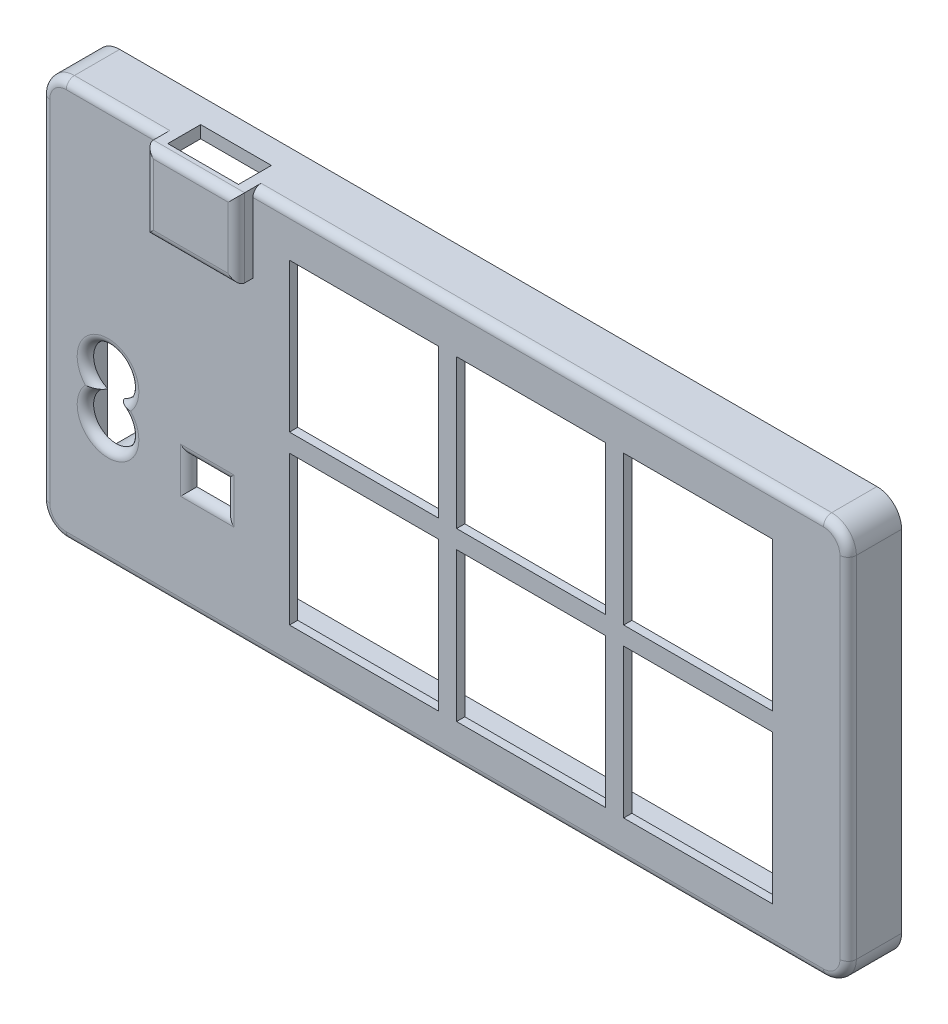
from build123d import *

# Parameters (mm, degrees)
SKETCH3_W                 = 98.075
SKETCH3_H                 = 48.545
SKETCH3_W_2               = 95.075
SKETCH3_H_2               = 45.545
WALL_DEPTH                = 6.5
SKETCH4_W                 = 98.075
SKETCH4_H                 = 48.545
TOPFACE_DEPTH             = 1
SKETCH7_R                 = 3
STANDOFFS_DEPTH           = 5.5
M2X0_4_TAPPED_HOLE1_D     = 1.6
M2X0_4_TAPPED_HOLE1_DEPTH = 4
M2X0_4_TAPPED_HOLE1_TIP   = 0.480688495
SKETCH5_W                 = 18.1
SKETCH5_H                 = 18.1
SKETCH5_W_2               = 4.5
SKETCH5_H_2               = 3.5
KEYCUT_DEPTH              = 210.455337542
SKETCH9_W                 = 11.1
SKETCH9_H                 = 9.5
USBEXTRUDE_DEPTH          = 2
SKETCH12_W                = 8.6
SKETCH12_H                = 4
USBCUT_DEPTH              = 8
FILLETSIDE_R              = 3
FILLETSIDEINNER_R         = 1.5
FILLETTOP_R               = 1
FILLETTOPINNER_R          = 1


with BuildPart() as part:
    # Sketch3 → Wall (new body)
    with BuildSketch(Plane.XY.offset(1.5)):
        with Locations((111.4425, -110.1725)):
            Rectangle(SKETCH3_W, SKETCH3_H)
        with Locations((111.4425, -110.1725)):
            Rectangle(SKETCH3_W_2, SKETCH3_H_2, mode=Mode.SUBTRACT)
    extrude(amount=WALL_DEPTH)

    # Sketch4 → TopFace (add)
    with BuildSketch(Plane.XY.offset(8)):
        with Locations((111.4425, -110.1725)):
            Rectangle(SKETCH4_W, SKETCH4_H)
    extrude(amount=-TOPFACE_DEPTH)

    # Sketch7 → Standoffs (add)
    with BuildSketch(Plane(origin=(0, 0, 7), x_dir=(-1, 0, 0), z_dir=(0, 0, -1))):
        with Locations(Location((-153.035, -93.345, 0), (0, 0, 180))):
            Circle(SKETCH7_R)
        with Locations(Location((-69.85, -93.98, 0), (0, 0, 180))):
            Circle(SKETCH7_R)
        with Locations(Location((-69.85, -127, 0), (0, 0, 180))):
            Circle(SKETCH7_R)
        with Locations(Location((-153.035, -127, 0), (0, 0, 180))):
            Circle(SKETCH7_R)
    extrude(amount=STANDOFFS_DEPTH)

    # M2x0.4 Tapped Hole1
    with Locations(Plane(origin=(0, 0, 1.5), x_dir=(-1, 0, 0), z_dir=(0, 0, -1))):
        with Locations((-153.035, -93.345), (-69.85, -93.98), (-153.035, -127), (-69.85, -127)):
            Hole(M2X0_4_TAPPED_HOLE1_D / 2, depth=M2X0_4_TAPPED_HOLE1_DEPTH)
            with Locations((0, 0, -(M2X0_4_TAPPED_HOLE1_DEPTH + M2X0_4_TAPPED_HOLE1_TIP / 2))):  # 118° drill point
                Cone(0, M2X0_4_TAPPED_HOLE1_D / 2, M2X0_4_TAPPED_HOLE1_TIP, mode=Mode.SUBTRACT)

    # Sketch5 → KeyCut (cut, through all)
    with BuildSketch(Plane.XY.offset(8)):
        with Locations((142.24, -120.65)):
            Rectangle(SKETCH5_W, SKETCH5_H)
        with Locations((121.92, -120.65)):
            Rectangle(SKETCH5_W, SKETCH5_H)
        with Locations((101.6, -120.65)):
            Rectangle(SKETCH5_W, SKETCH5_H)
        with Locations((101.6, -100.33)):
            Rectangle(SKETCH5_W, SKETCH5_H)
        with Locations((142.24, -100.33)):
            Rectangle(SKETCH5_W, SKETCH5_H)
        with Locations((121.92, -100.33)):
            Rectangle(SKETCH5_W, SKETCH5_H)
        with Locations((82.55, -120.02)):
            Rectangle(SKETCH5_W_2, SKETCH5_H_2)
        with BuildLine():
            ThreePointArc((71.53899241, -116.84), (70.485, -111.55), (69.43100759, -116.84))
            ThreePointArc((69.43100759, -116.84), (70.485, -122.13), (71.53899241, -116.84))
        make_face()
    extrude(amount=-KEYCUT_DEPTH, mode=Mode.SUBTRACT)

    # Sketch9 → USBExtrude (add)
    with BuildSketch(Plane.XY.offset(8)):
        with Locations((82.55, -90.65)):
            Rectangle(SKETCH9_W, SKETCH9_H)
    extrude(amount=USBEXTRUDE_DEPTH)

    # Sketch12 → USBCut (cut)
    with BuildSketch(Plane(origin=(0, -85.9, 0), x_dir=(1, 0, 0), z_dir=(0, 1, 0))):
        with Locations((82.55, -6.5)):
            Rectangle(SKETCH12_W, SKETCH12_H)
    extrude(amount=-USBCUT_DEPTH, mode=Mode.SUBTRACT)

    # FilletSide
    filletside_edges = [part.edges().sort_by_distance(p)[0] for p in [
        (62.405, -134.445, 4.75),
        (62.405, -85.9, 4.75),
        (160.48, -85.9, 4.75),
        (160.48, -134.445, 4.75),
    ]]
    fillet(filletside_edges, radius=FILLETSIDE_R)

    # FilletSideInner
    filletsideinner_edges = [part.edges().sort_by_distance(p)[0] for p in [
        (63.905, -132.945, 4.25),
        (158.98, -132.945, 4.25),
        (63.905, -87.4, 4.25),
        (158.98, -87.4, 4.25),
    ]]
    fillet(filletsideinner_edges, radius=FILLETSIDEINNER_R)

    # FilletTop
    fillettop_edges = [part.edges().sort_by_distance(p)[0] for p in [
        (82.55, -95.4, 10),
        (77, -90.65, 10),
        (82.55, -85.9, 10),
        (88.1, -90.65, 10),
        (71.2025, -85.9, 8),
        (63.283679656, -86.778679656, 8),
        (62.405, -110.1725, 8),
        (63.283679656, -133.566320344, 8),
        (111.4425, -134.445, 8),
        (159.601320344, -133.566320344, 8),
        (160.48, -110.1725, 8),
        (159.601320344, -86.778679656, 8),
        (122.79, -85.9, 8),
        (82.55, -121.77, 8),
        (84.8, -120.02, 8),
        (82.55, -118.27, 8),
        (80.3, -120.02, 8),
        (70.485, -122.13, 8),
        (70.485, -111.55, 8),
    ]]
    fillet(fillettop_edges, radius=FILLETTOP_R - 0.0001)  # a hair under: the kernel refuses the full size

    # FilletTopInner
    fillettopinner_edges = [part.edges().sort_by_distance(p)[0] for p in [
        (156.021354145, -93.059187267, 7),
        (66.85, -93.98, 7),
        (66.85, -127, 7),
        (156.035, -127, 7),
    ]]
    fillet(fillettopinner_edges, radius=FILLETTOPINNER_R)


solid = part.part
